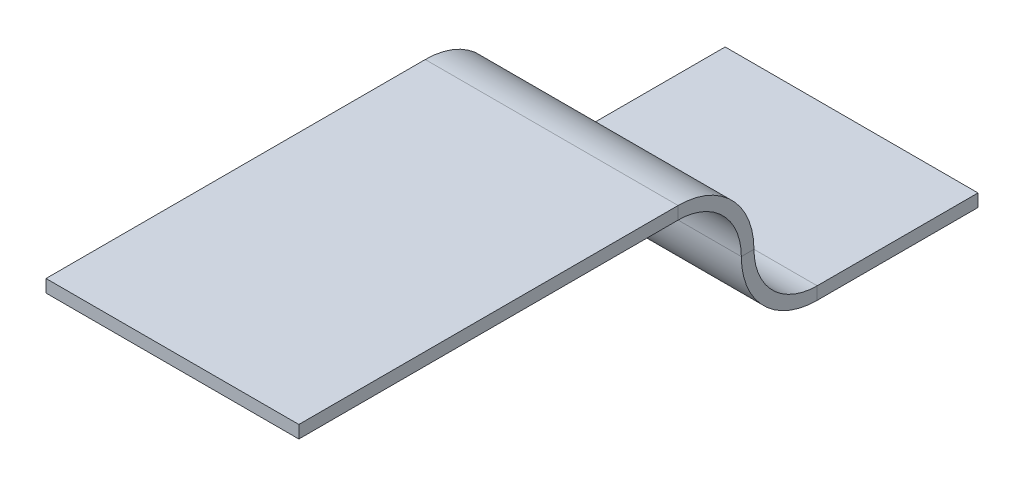
from build123d import *

# Parameters (mm, degrees)
SKETCH1_W          = 20
SKETCH1_H          = 60
BASE_FLANGE1_DEPTH = 1
JOG1_START         = -12.932862191
JOG1_DEPTH         = 20
JOG1_2_DEPTH       = 20


# Read off the part's stored shape, not the designer's step: Jog1
# Sheet-metal steps are written as plain solids
with BuildPart() as part:
    # Sketch1 → Base-Flange1 (new body)
    with BuildSketch(Plane(origin=(0, 0, 0), x_dir=(1, 0, 0), z_dir=(0, 1, 0))):
        with Locations((-2.932862191, 4.770318021)):
            Rectangle(SKETCH1_W, SKETCH1_H)
    extrude(amount=-BASE_FLANGE1_DEPTH)

    # Jog1 outline → Jog1 (cut)
    with BuildSketch(Plane.YZ.offset(JOG1_START)):
        with BuildLine():
            ThreePointArc((0, -4.770318021), (-0.255437354, -6.502368828), (-1, -8.086942811))
            Line((-1, -8.086942811), (-1, -34.770318021))
            Line((-1, -34.770318021), (0, -34.770318021))
            Line((0, -34.770318021), (0, -4.770318021))
        make_face()
    extrude(amount=JOG1_DEPTH, mode=Mode.SUBTRACT)

    # Jog1 2 outline → Jog1 2 (add)
    with BuildSketch(Plane.YZ.offset(JOG1_START)):
        with BuildLine():
            ThreePointArc((-1, -4.770318021), (-2.464466094, -8.305851927), (-6, -9.770318021))
            ThreePointArc((-6, -9.770318021), (-10.242640687, -11.527677334), (-12, -15.770318021))
            Line((-12, -15.770318021), (-12, -28.491558426))
            Line((-12, -28.491558426), (-11, -28.491558426))
            Line((-11, -28.491558426), (-11, -15.770318021))
            ThreePointArc((-11, -15.770318021), (-9.535533906, -12.234784115), (-6, -10.770318021))
            ThreePointArc((-6, -10.770318021), (-3.162725669, -10.057082095), (-1, -8.086942811))
            Line((-1, -8.086942811), (-1, -4.770318021))
        make_face()
    extrude(amount=JOG1_2_DEPTH)


solid = part.part
